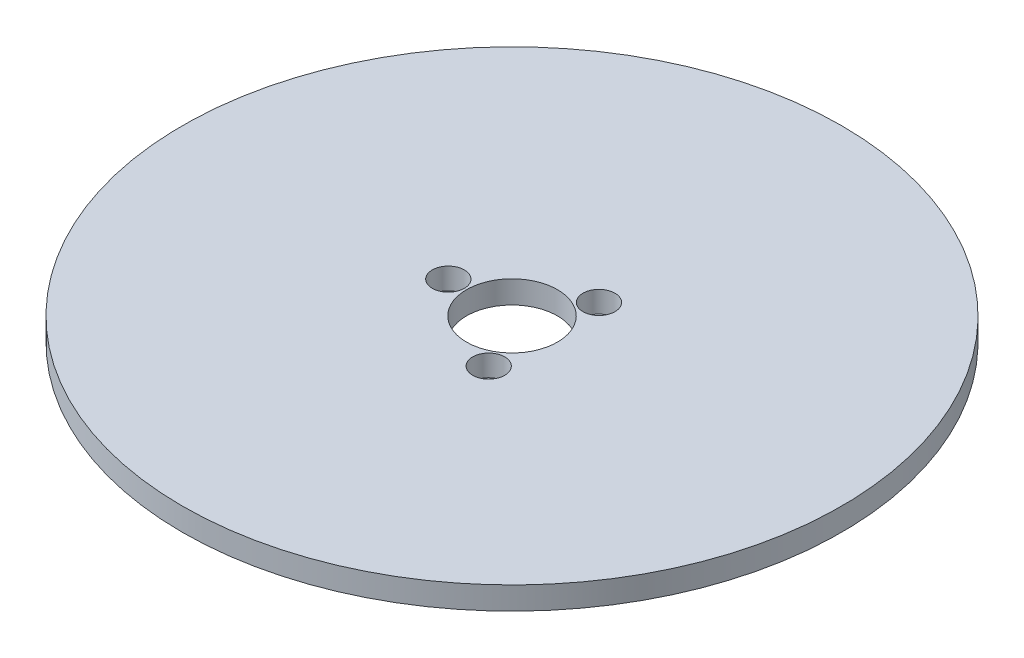
from build123d import *

# Parameters (mm, degrees)
SKETCH1_R           = 72.5
BOSS_EXTRUDE1_DEPTH = 5
SKETCH2_R           = 10
CUT_EXTRUDE1_DEPTH  = 103.652325838
SKETCH3_R           = 3.525017378
CUT_EXTRUDE2_DEPTH  = 4.708016116
CIRPATTERN1_COUNT   = 3


with BuildPart() as part:
    # Sketch1 → Boss-Extrude1 (new body)
    with BuildSketch(Plane(origin=(0, 0, 0), x_dir=(1, 0, 0), z_dir=(0, 1, 0))):
        Circle(SKETCH1_R)
    extrude(amount=BOSS_EXTRUDE1_DEPTH)

    # Sketch2 → Cut-Extrude1 (cut, through all)
    with BuildSketch(Plane(origin=(0, 0, 0), x_dir=(1, 0, 0), z_dir=(0, 1, 0))):
        Circle(SKETCH2_R)
    extrude(amount=CUT_EXTRUDE1_DEPTH, mode=Mode.SUBTRACT)

    # Sketch3 → Cut-Extrude2 (cut)
    with BuildSketch(Plane(origin=(0, 5, 0), x_dir=(1, 0, 0), z_dir=(0, 1, 0))):
        with Locations((-14.005246001, 0)):
            Circle(SKETCH3_R)
    cut_extrude2 = extrude(amount=-CUT_EXTRUDE2_DEPTH, mode=Mode.SUBTRACT)

    # CirPattern1: Cut-Extrude2 ×3 about axis
    cirpattern1_axis = Axis((0, 0, 0), (0, 1, 0))
    for i in range(1, CIRPATTERN1_COUNT):
        add(cut_extrude2.rotate(cirpattern1_axis, i * 360 / CIRPATTERN1_COUNT), mode=Mode.SUBTRACT)


solid = part.part
